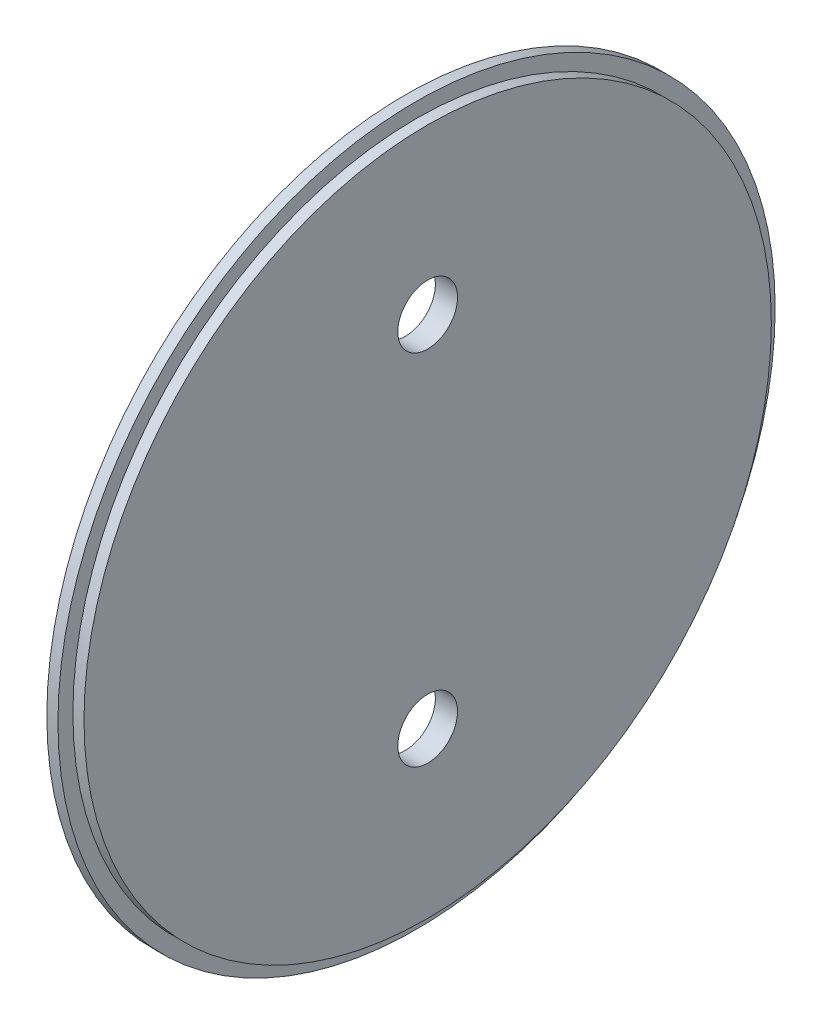
from build123d import *

# Parameters (mm, degrees)
SKETCH1_R           = 38.1
BOSS_EXTRUDE1_DEPTH = 1.1811
SKETCH2_R           = 36.5125
BOSS_EXTRUDE2_DEPTH = 1.1811
SKETCH3_R           = 3.175
CUT_EXTRUDE1_DEPTH  = 54.933292027


with BuildPart() as part:
    # Sketch1 → Boss-Extrude1 (new body)
    with BuildSketch(Plane.YZ):
        Circle(SKETCH1_R)
    extrude(amount=BOSS_EXTRUDE1_DEPTH)

    # Sketch2 → Boss-Extrude2 (add)
    with BuildSketch(Plane.YZ.offset(1.1811)):
        Circle(SKETCH2_R)
    extrude(amount=BOSS_EXTRUDE2_DEPTH)

    # Sketch3 → Cut-Extrude1 (cut, through all)
    with BuildSketch(Plane(origin=(0, 0, 0), x_dir=(0, -1, 0), z_dir=(-1, 0, 0))):
        with Locations((19.05, 0)):
            Circle(SKETCH3_R)
        with Locations((-19.05, 0)):
            Circle(SKETCH3_R)
    extrude(amount=-CUT_EXTRUDE1_DEPTH, mode=Mode.SUBTRACT)


solid = part.part
